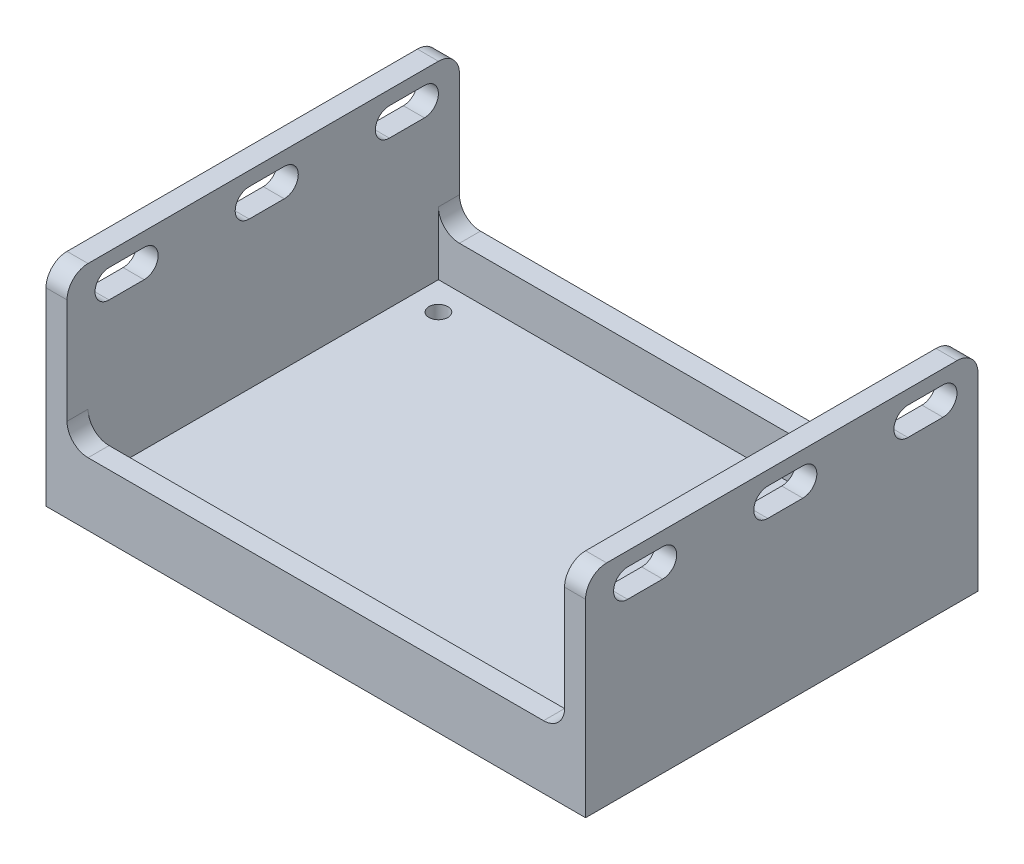
from build123d import *

# Parameters (mm, degrees)
SKETCH1_W           = 71
SKETCH1_H           = 50
SKETCH1_R           = 1.35
BOSS_EXTRUDE1_DEPTH = 3
SKETCH2_W           = 77
SKETCH2_H           = 56
SKETCH2_W_2         = 71
SKETCH2_H_2         = 50
BOSS_EXTRUDE2_DEPTH = 30
SKETCH3_W           = 71
SKETCH3_H           = 30
CUT_EXTRUDE1_DEPTH  = 75.284924446
CUT_EXTRUDE2_DEPTH  = 88.252507127
FILLET1_R           = 3


with BuildPart() as part:
    # Sketch1 → Boss-Extrude1 (new body)
    with BuildSketch(Plane(origin=(0, 0, 0), x_dir=(1, 0, 0), z_dir=(0, 1, 0))):
        Rectangle(SKETCH1_W, SKETCH1_H)
        with Locations((-31.5, 21)):
            Circle(SKETCH1_R, mode=Mode.SUBTRACT)
        with Locations((31.5, 21)):
            Circle(SKETCH1_R, mode=Mode.SUBTRACT)
        with Locations((31.5, -21)):
            Circle(SKETCH1_R, mode=Mode.SUBTRACT)
        with Locations((-31.5, -21)):
            Circle(SKETCH1_R, mode=Mode.SUBTRACT)
    extrude(amount=BOSS_EXTRUDE1_DEPTH)

    # Sketch2 → Boss-Extrude2 (add)
    with BuildSketch(Plane(origin=(0, 0, 0), x_dir=(1, 0, 0), z_dir=(0, 1, 0))):
        Rectangle(SKETCH2_W, SKETCH2_H)
        Rectangle(SKETCH2_W_2, SKETCH2_H_2, mode=Mode.SUBTRACT)
    extrude(amount=BOSS_EXTRUDE2_DEPTH)

    # Sketch3 → Cut-Extrude1 (cut, through all)
    with BuildSketch(Plane(origin=(0, 0, -28), x_dir=(-1, 0, 0), z_dir=(0, 0, -1))):
        with Locations((0, 24)):
            Rectangle(SKETCH3_W, SKETCH3_H)
    extrude(amount=-CUT_EXTRUDE1_DEPTH, mode=Mode.SUBTRACT)

    # Sketch4 → Cut-Extrude2 (cut, through all)
    with BuildSketch(Plane.ZY.offset(38.5)):
        with BuildLine():
            Line((-18, 24), (-23, 24))
            ThreePointArc((-23, 24), (-25, 26), (-23, 28))
            Line((-23, 28), (-18, 28))
            ThreePointArc((-18, 28), (-16, 26), (-18, 24))
        make_face()
        with BuildLine():
            Line((2, 28), (-3, 28))
            ThreePointArc((-3, 28), (-5, 26), (-3, 24))
            Line((-3, 24), (2, 24))
            ThreePointArc((2, 24), (4, 26), (2, 28))
        make_face()
        with BuildLine():
            Line((22, 28), (17, 28))
            ThreePointArc((17, 28), (15, 26), (17, 24))
            Line((17, 24), (22, 24))
            ThreePointArc((22, 24), (24, 26), (22, 28))
        make_face()
    extrude(amount=-CUT_EXTRUDE2_DEPTH, mode=Mode.SUBTRACT)

    # Fillet1
    fillet1_edges = [part.edges().sort_by_distance(p)[0] for p in [
        (-37, 30, 28),
        (-37, 30, -28),
        (37, 30, 28),
        (37, 30, -28),
        (-35.5, 9, -26.5),
        (-35.5, 9, 26.5),
        (35.5, 9, 26.5),
        (35.5, 9, -26.5),
    ]]
    fillet(fillet1_edges, radius=FILLET1_R)


solid = part.part
